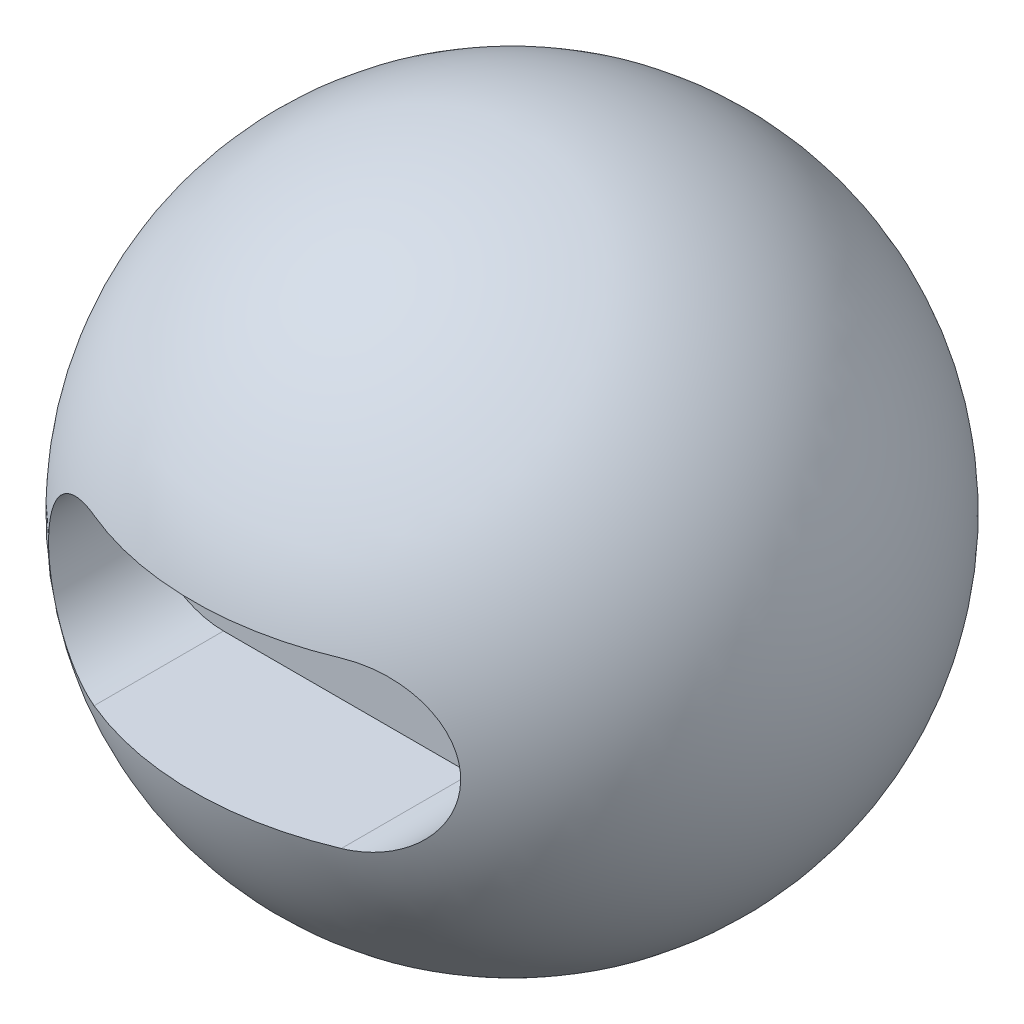
from build123d import *

# Parameters (mm, degrees)
CUT_EXTRUDE2_DEPTH = 500


with BuildPart() as part:
    # Sketch1 → Revolve1 (revolve)
    with BuildSketch(Plane.XY):
        with BuildLine():
            Line((0, -1000), (0, 1000))
            ThreePointArc((0, 1000), (-1000, 0), (0, -1000))
        make_face()
    revolve(axis=Axis((0, -1000, 0), (0, 1, 0)))

    # Sketch7 → Cut-Extrude2 (cut)
    with BuildSketch(Plane.XY.offset(1000)):
        with BuildLine():
            Line((-375, 250), (375, 250))
            ThreePointArc((375, 250), (625, 0), (375, -250))
            Line((375, -250), (-375, -250))
            ThreePointArc((-375, -250), (-625, 0), (-375, 250))
        make_face()
    extrude(amount=-CUT_EXTRUDE2_DEPTH, mode=Mode.SUBTRACT)


solid = part.part
